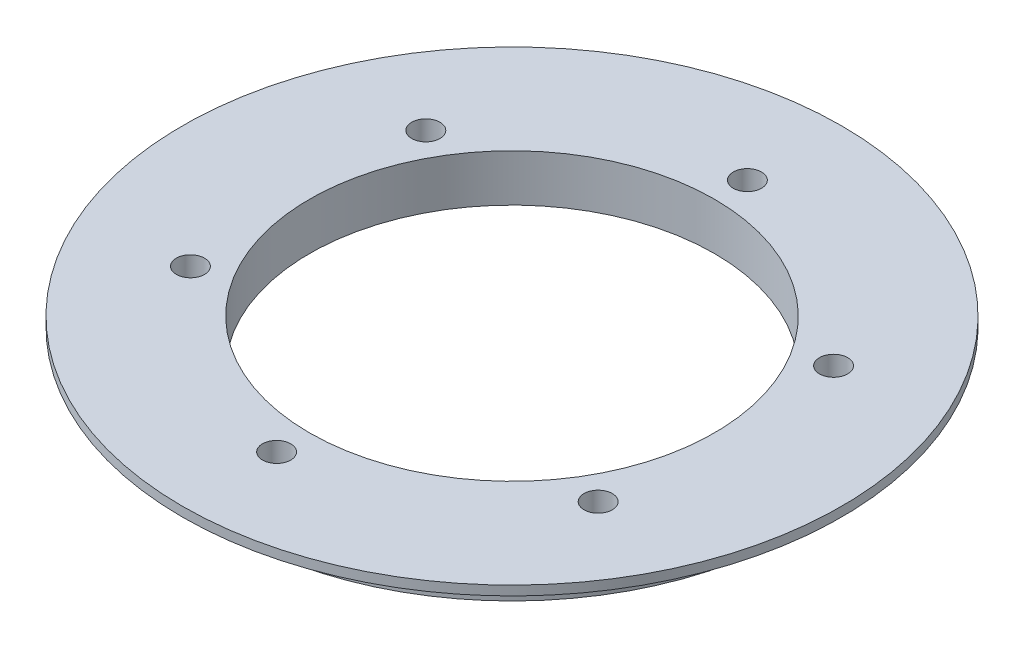
from build123d import *

# Parameters (mm, degrees)
SKETCH1_R           = 30
BOSS_EXTRUDE1_DEPTH = 5
SKETCH2_R           = 35
BOSS_EXTRUDE2_DEPTH = 1
SKETCH3_R           = 21.5
CUT_EXTRUDE1_DEPTH  = 25
SKETCH4_R           = 1.5
CUT_EXTRUDE2_DEPTH  = 25


with BuildPart() as part:
    # Sketch1 → Boss-Extrude1 (new body)
    with BuildSketch(Plane(origin=(0, 0, 0), x_dir=(1, 0, 0), z_dir=(0, 1, 0))):
        Circle(SKETCH1_R)
    extrude(amount=BOSS_EXTRUDE1_DEPTH)

    # Sketch2 → Boss-Extrude2 (add)
    with BuildSketch(Plane(origin=(0, 5, 0), x_dir=(1, 0, 0), z_dir=(0, 1, 0))):
        Circle(SKETCH2_R)
    extrude(amount=-BOSS_EXTRUDE2_DEPTH)

    # Sketch3 → Cut-Extrude1 (cut)
    with BuildSketch(Plane.XZ):
        Circle(SKETCH3_R)
    extrude(amount=-CUT_EXTRUDE1_DEPTH, mode=Mode.SUBTRACT)

    # Sketch4 → Cut-Extrude2 (cut)
    with BuildSketch(Plane(origin=(0, 5, 0), x_dir=(1, 0, 0), z_dir=(0, 1, 0))):
        with Locations((0, 25)):
            Circle(SKETCH4_R)
        with Locations((21.650635095, 12.5)):
            Circle(SKETCH4_R)
        with Locations((21.650635095, -12.5)):
            Circle(SKETCH4_R)
        with Locations((0, -25)):
            Circle(SKETCH4_R)
        with Locations((-21.650635095, -12.5)):
            Circle(SKETCH4_R)
        with Locations((-21.650635095, 12.5)):
            Circle(SKETCH4_R)
    extrude(amount=-CUT_EXTRUDE2_DEPTH, mode=Mode.SUBTRACT)


solid = part.part
